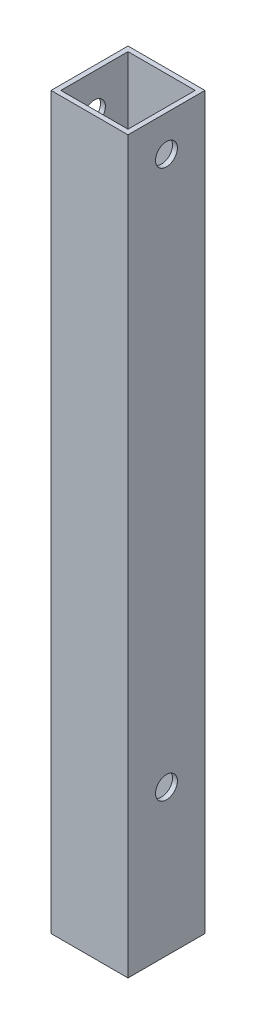
from build123d import *

# Parameters (mm, degrees)
SKETCH1_W           = 15.8
SKETCH1_H           = 15.8
SKETCH1_W_2         = 13.8
SKETCH1_H_2         = 13.8
BOSS_EXTRUDE1_DEPTH = 150
SKETCH2_R           = 2.25
CUT_EXTRUDE1_DEPTH  = 152.036584972


with BuildPart() as part:
    # Sketch1 → Boss-Extrude1 (new body)
    with BuildSketch(Plane(origin=(0, 0, 0), x_dir=(1, 0, 0), z_dir=(0, 1, 0))):
        Rectangle(SKETCH1_W, SKETCH1_H)
        Rectangle(SKETCH1_W_2, SKETCH1_H_2, mode=Mode.SUBTRACT)
    extrude(amount=BOSS_EXTRUDE1_DEPTH)

    # Sketch2 → Cut-Extrude1 (cut, through all)
    with BuildSketch(Plane.ZY.offset(7.9)):
        with Locations((0, 142.6)):
            Circle(SKETCH2_R)
        with Locations((0, 30)):
            Circle(SKETCH2_R)
    extrude(amount=-CUT_EXTRUDE1_DEPTH, mode=Mode.SUBTRACT)


solid = part.part
